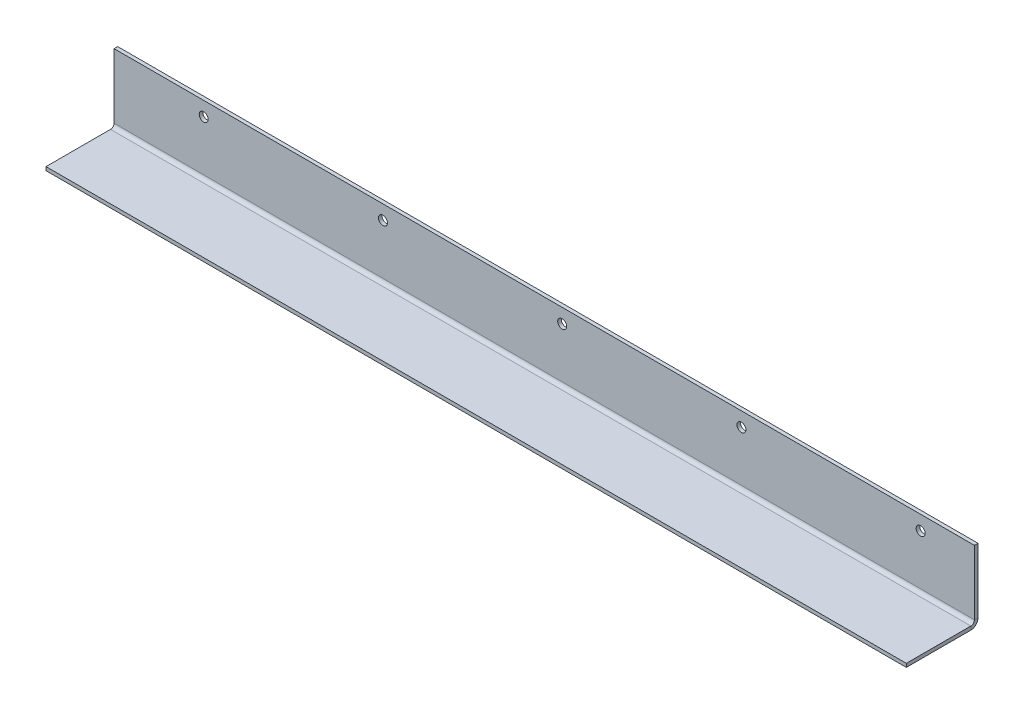
from build123d import *

# Parameters (mm, degrees)
SKETCH_1_W                       = 480
SKETCH_1_H                       = 40
SM_BASE_FLANGE_1_DEPTH           = 2
SM_EDGE_FLANGE_1_STRIP_W         = 12
SM_EDGE_FLANGE_1_STRIP_H         = 2
SM_EDGE_FLANGE_1_STRIP_CUT_DEPTH = 480
SM_EDGE_FLANGE_1_DEPTH           = 480
SKETCH_9_R                       = 2.5
CUT_EXTRUDE_1_DEPTH              = 484.160428843


# Sheet-metal steps are written as plain solids
with BuildPart() as part:
    # Sketch 1 → Базовая кромка1 (new body)
    with BuildSketch(Plane(origin=(0, 0, 0), x_dir=(1, 0, 0), z_dir=(0, 1, 0))):
        with Locations((240, 20)):
            Rectangle(SKETCH_1_W, SKETCH_1_H)
    extrude(amount=-SM_BASE_FLANGE_1_DEPTH)

    # Ребро-кромка1 strip (across the edge) → Ребро-кромка1 strip cut (cut)
    with BuildSketch(Plane(origin=(480, 0, -40), x_dir=(0, 0, 1), z_dir=(-1, 0, 0))):
        with Locations((-2, -1)):
            Rectangle(SM_EDGE_FLANGE_1_STRIP_W, SM_EDGE_FLANGE_1_STRIP_H)
    extrude(amount=SM_EDGE_FLANGE_1_STRIP_CUT_DEPTH, mode=Mode.SUBTRACT)

    # Ребро-кромка1 section (across the edge) → Ребро-кромка1 (add)
    with BuildSketch(Plane(origin=(480, 0, -40), x_dir=(0, 0, 1), z_dir=(-1, 0, 0))):
        with BuildLine():
            Line((0, 2), (0, 38))
            Line((0, 38), (2, 38))
            Line((2, 38), (2, 2))
            ThreePointArc((2, 2), (2.585786438, 0.585786438), (4, 0))
            Line((4, 0), (4, -2))
            ThreePointArc((4, -2), (1.171572875, -0.828427125), (0, 2))
        make_face()
    extrude(amount=SM_EDGE_FLANGE_1_DEPTH)

    # Эскиз9 → Вырез-Вытянуть1 (cut, through all)
    with BuildSketch(Plane(origin=(0, 0, -40), x_dir=(-1, 0, 0), z_dir=(0, 0, -1))):
        with Locations(Location((-450, 30, 0), (0, 0, 90))):
            Circle(SKETCH_9_R)
        with Locations(Location((-350, 30, 0), (0, 0, 90))):
            Circle(SKETCH_9_R)
        with Locations(Location((-250, 30, 0), (0, 0, 90))):
            Circle(SKETCH_9_R)
        with Locations(Location((-150, 30, 0), (0, 0, 90))):
            Circle(SKETCH_9_R)
        with Locations(Location((-50, 30, 0), (0, 0, 90))):
            Circle(SKETCH_9_R)
    extrude(amount=-CUT_EXTRUDE_1_DEPTH, mode=Mode.SUBTRACT)


solid = part.part
